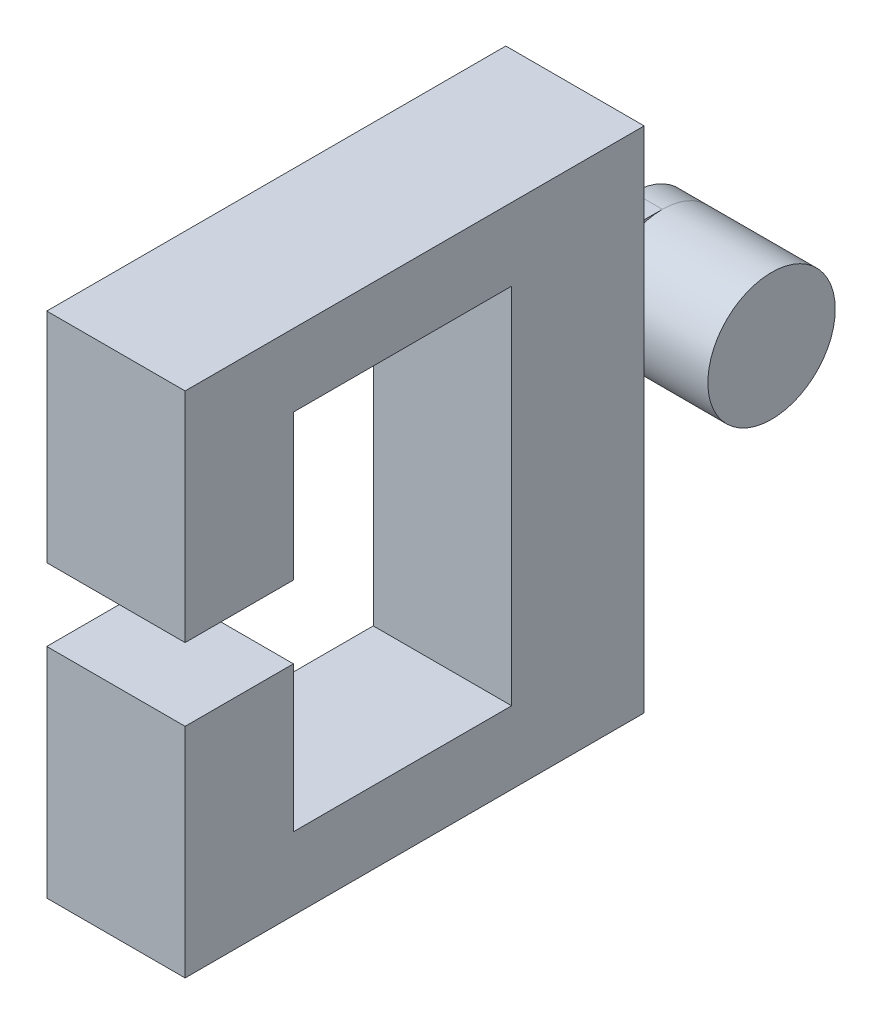
from build123d import *

# Parameters (mm, degrees)
SKETCH1_R           = 11.112754
BOSS_EXTRUDE1_DEPTH = 9.525
SKETCH2_W           = 22.225508
SKETCH2_H           = 33.338262
BOSS_EXTRUDE2_DEPTH = 5.091684
FILLET1_R           = 11.112754
FILLET2_R           = 11.112754
SKETCH1_3_W         = 12.6492
SKETCH1_3_H         = 38.0746
BOSS_EXTRUDE3_DEPTH = 9.525
BOSS_EXTRUDE6_DEPTH = 5.091684


with BuildPart() as part:
    # Sketch1 → Boss-Extrude1 (new, symmetric)
    with BuildSketch(Plane.YZ):
        with Locations(Location((0, -22.225508, 0), (0, 0, 90))):
            Circle(SKETCH1_R)
    extrude(amount=BOSS_EXTRUDE1_DEPTH, both=True)

    # Sketch2 → Boss-Extrude2 (add)
    with BuildSketch(Plane(origin=(-9.525, 0, 0), x_dir=(0, -1, 0), z_dir=(-1, 0, 0))):
        with Locations((0, -16.669131)):
            Rectangle(SKETCH2_W, SKETCH2_H)
    extrude(amount=BOSS_EXTRUDE2_DEPTH)

    # Fillet1
    fillet1_edges = [part.edges().sort_by_distance(p)[0] for p in [
        (-12.070842, 11.112754, -33.338262),
    ]]
    fillet(fillet1_edges, radius=FILLET1_R)

    # Fillet2
    fillet2_edges = [part.edges().sort_by_distance(p)[0] for p in [
        (-12.070842, -11.112754, -33.338262),
    ]]
    fillet(fillet2_edges, radius=FILLET2_R - 0.0001)  # a hair under: the kernel refuses the full size



with BuildPart() as body_2:
    # Sketch1<3> → Boss-Extrude3 (new, symmetric)
    with BuildSketch(Plane.YZ):
        with Locations((-38.02888, 42.162476)):
            Rectangle(SKETCH1_3_W, SKETCH1_3_H)
        Polygon((-31.70428, 23.125176), (-44.35348, 23.125176), (-44.35348, 0), (44.35348, 0), (44.35348, 23.125176), (31.70428, 23.125176), align=None)
        Polygon((-44.35348, 80.091534), (-44.35348, 61.199776), (-31.70428, 61.199776), (-6.3246, 61.199776), (-6.3246, 80.091534), align=None)
        with Locations((38.02888, 42.162476)):
            Rectangle(SKETCH1_3_W, SKETCH1_3_H)
        Polygon((6.3246, 61.199776), (31.70428, 61.199776), (44.35348, 61.199776), (44.35348, 80.091534), (6.3246, 80.091534), align=None)
    extrude(amount=BOSS_EXTRUDE3_DEPTH, both=True)


with BuildPart() as part_1:
    add(part.part)

    add(body_2.part)  # Boss-Extrude6 merges body 2
    # Sketch8 → Boss-Extrude6 (add)
    with BuildSketch(Plane(origin=(-9.525, 0, 0), x_dir=(0, -1, 0), z_dir=(-1, 0, 0))):
        Polygon((31.70428, 61.199776), (31.70428, 23.125176), (-31.70428, 23.125176), (-31.70428, 61.199776), (-6.3246, 61.199776), (-6.3246, 80.091534), (-44.35348, 80.091534), (-44.35348, 0), (44.35348, 0), (44.35348, 80.091534), (6.3246, 80.091534), (6.3246, 61.199776), align=None)
    extrude(amount=BOSS_EXTRUDE6_DEPTH)


solid = part_1.part
